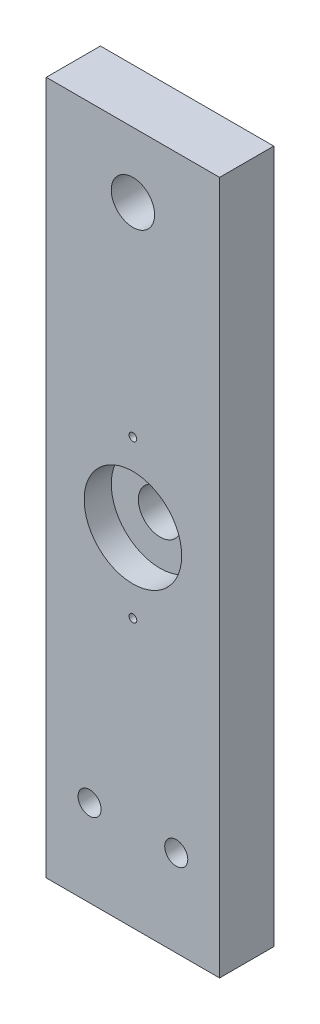
from build123d import *

# Parameters (mm, degrees)
SKETCH1_W                   = 50.8
SKETCH1_H                   = 203.2
BOSS_EXTRUDE1_DEPTH         = 15.875
F_1_4_CLEARANCE_HOLE1_D     = 6.7564
SKETCH5_R                   = 6.35
CUT_EXTRUDE1_DEPTH          = 181.305339979
SKETCH6_R                   = 14.2875
CUT_EXTRUDE2_DEPTH          = 7.9375
F_4_40_TAPPED_HOLE1_D       = 2.2606
F_4_40_TAPPED_HOLE1_DEPTH   = 7.62
F_4_40_TAPPED_HOLE1_TIP     = 0.679152758
F_1_4_20_TAPPED_HOLE1_D     = 5.1054
F_1_4_20_TAPPED_HOLE1_DEPTH = 16.51
F_1_4_20_TAPPED_HOLE1_TIP   = 1.533816902


with BuildPart() as part:
    # Sketch1 → Boss-Extrude1 (new body)
    with BuildSketch(Plane.XY):
        with Locations((0, 76.2)):
            Rectangle(SKETCH1_W, SKETCH1_H)
    extrude(amount=BOSS_EXTRUDE1_DEPTH)

    # 1/4 Clearance Hole1 (through all)
    with Locations(Plane.XY.offset(15.875)):
        with Locations((12.7, 0), (-12.7, 0)):
            Hole(F_1_4_CLEARANCE_HOLE1_D / 2)

    # Sketch5 → Cut-Extrude1 (cut, through all)
    with BuildSketch(Plane(origin=(0, 0, 0), x_dir=(-1, 0, 0), z_dir=(0, 0, -1))):
        with Locations((0, 158.75)):
            Circle(SKETCH5_R)
        with Locations((0, 76.2)):
            Circle(SKETCH5_R)
    extrude(amount=-CUT_EXTRUDE1_DEPTH, mode=Mode.SUBTRACT)

    # Sketch6 → Cut-Extrude2 (cut)
    with BuildSketch(Plane.XY.offset(15.875)):
        with Locations((0, 76.2)):
            Circle(SKETCH6_R)
    extrude(amount=-CUT_EXTRUDE2_DEPTH, mode=Mode.SUBTRACT)

    # #4-40 Tapped Hole1
    with Locations(Plane.XY.offset(15.875)):
        with Locations((0, 99.187), (0, 53.213)):
            Hole(F_4_40_TAPPED_HOLE1_D / 2, depth=F_4_40_TAPPED_HOLE1_DEPTH)
            with Locations((0, 0, -(F_4_40_TAPPED_HOLE1_DEPTH + F_4_40_TAPPED_HOLE1_TIP / 2))):  # 118° drill point
                Cone(0, F_4_40_TAPPED_HOLE1_D / 2, F_4_40_TAPPED_HOLE1_TIP, mode=Mode.SUBTRACT)

    # 1/4-20 Tapped Hole1
    with Locations(Plane.ZY.offset(25.4)):
        with Locations((7.9375, 139.7), (7.9375, 107.95)):
            Hole(F_1_4_20_TAPPED_HOLE1_D / 2, depth=F_1_4_20_TAPPED_HOLE1_DEPTH)
            with Locations((0, 0, -(F_1_4_20_TAPPED_HOLE1_DEPTH + F_1_4_20_TAPPED_HOLE1_TIP / 2))):  # 118° drill point
                Cone(0, F_1_4_20_TAPPED_HOLE1_D / 2, F_1_4_20_TAPPED_HOLE1_TIP, mode=Mode.SUBTRACT)


solid = part.part
